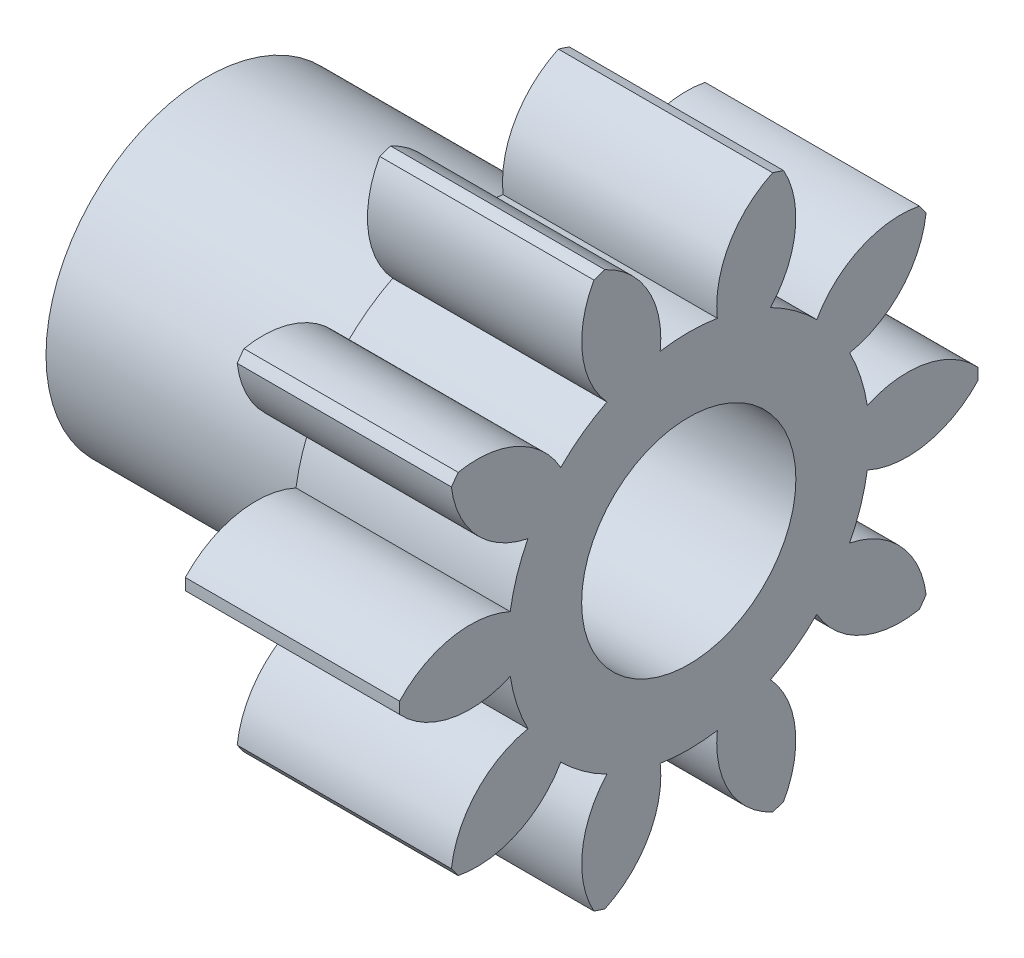
from build123d import *

# Parameters (mm, degrees)
BASPROSKE_W        = 4
BASPROSKE_H        = 5.4
TOOTHCUT_DEPTH     = 9.620904825
TEETHCUTS_COUNT    = 10
TEETHCUTS_ANGLE    = 324
HUBNEAONESKE_R     = 3
HUBNEARONE_DEPTH   = 5.0000508
BORSKE_R           = 2
BORE_DEPTH         = 9.0000508
SKETCH8_2_R        = 1.25
CUT_EXTRUDE1_DEPTH = 2
CUT_SWEEP1_PITCH   = 0.5


with BuildPart() as part:
    # BasProSke → Base-Revolve (revolve)
    with BuildSketch(Plane(origin=(0, 0, 0), x_dir=(1, 0, 0), z_dir=(0, 1, 0)), mode=Mode.PRIVATE) as base_revolve_sk:
        with Locations((2, 2.7)):
            Rectangle(BASPROSKE_W, BASPROSKE_H)
    revolve(base_revolve_sk.sketch.rotate(Axis((-10, 0, 0), (1, 0, 0)), 180), axis=Axis((-10, 0, 0), (1, 0, 0)))

    # TooCutSke → ToothCut (cut, through all)
    with BuildSketch(Plane(origin=(0, 0, 0), x_dir=(0, 0, -1), z_dir=(1, 0, 0))):
        with BuildLine():
            ThreePointArc((0.533254479, 3.331593562), (0, 3.374), (-0.533254479, 3.331593562))
            ThreePointArc((-0.533254479, 3.331593562), (-0.762529915, 4.433401636), (-1.601346956, 5.183691068))
            ThreePointArc((-1.601346956, 5.183691068), (0, 5.4254), (1.601346956, 5.183691068))
            ThreePointArc((1.601346956, 5.183691068), (0.762529915, 4.433401636), (0.533254479, 3.331593562))
        make_face()
    toothcut = extrude(amount=TOOTHCUT_DEPTH, mode=Mode.SUBTRACT)

    # TeethCuts: ToothCut ×10 about axis
    teethcuts_axis = Axis((-10, 0, 0), (1, 0, 0))
    for i in range(1, TEETHCUTS_COUNT):
        add(toothcut.rotate(teethcuts_axis, i * TEETHCUTS_ANGLE / (TEETHCUTS_COUNT - 1)), mode=Mode.SUBTRACT)

    # HubNeaOneSke → HubNearOne (add)
    with BuildSketch(Plane.ZY):
        with Locations(Location((0, 0, 0), (0, 0, 180))):
            Circle(HUBNEAONESKE_R)
    extrude(amount=HUBNEARONE_DEPTH)

    # BorSke → Bore (cut, symmetric)
    with BuildSketch(Plane(origin=(0, 0, 0), x_dir=(0, 0, -1), z_dir=(1, 0, 0))):
        with Locations(Location((0, 0, 0), (0, 0, 180))):
            Circle(BORSKE_R)
    extrude(amount=BORE_DEPTH, both=True, mode=Mode.SUBTRACT)

    # Sketch8<2> → Cut-Extrude1 (cut)
    with BuildSketch(Plane(origin=(0, -3, 0), x_dir=(-1, 0, 0), z_dir=(0, -1, 0))):
        with Locations(Location((2.5, 0, 0), (0, 0, 90))):
            Circle(SKETCH8_2_R)
    extrude(amount=-CUT_EXTRUDE1_DEPTH, mode=Mode.SUBTRACT)

    # Cut-Sweep1: arcs per turn and ends read off the stored shape
    # Cut-Sweep1: the profile of Sketch10 profile screwed along a right-hand helix through 7 turns, 6 arcs to a turn; built about Z, then put on its axis
    cut_sweep1_z = Axis((0, 0, 0), (0, 0, 1))
    cut_sweep1_corners = [(1.2497, 0, -0.372644269), (1.425, 0, -0.473853771), (1.45, 0, -0.517155041), (1.425, 0, -0.560456311), (1.2497, 0, -0.661665813)]
    with BuildLine(mode=Mode.PRIVATE) as cut_sweep1_profile:
        Line(cut_sweep1_corners[0], cut_sweep1_corners[1])
        Line(cut_sweep1_corners[3], cut_sweep1_corners[4])
        Line(cut_sweep1_corners[4], cut_sweep1_corners[0])
        ThreePointArc((1.425, 0, -0.473853771), (1.44330127, 0, -0.492155041), (1.45, 0, -0.517155041))
        ThreePointArc((1.45, 0, -0.517155041), (1.44330127, 0, -0.542155041), (1.425, 0, -0.560456311))
    cut_sweep1_cap = Face(cut_sweep1_profile.wire())
    cut_sweep1_arcs = [((1.425, 0, -0.473853771), (1.45, 0, -0.488287527), (1.45, 0, -0.517155041), (1, 0.8660254037844333, 1)), ((1.45, 0, -0.517155041), (1.45, 0, -0.546022554), (1.425, 0, -0.560456311), (1, 0.8660254037844333, 1))]  # start, shoulder, end, weights
    cut_sweep1_turn_angles = [0, 30, 60, 90, 120, 150, 180, 210, 240, 270, 300, 330, 360]
    cut_sweep1_turn_weights = [1, 0.8660254037844387, 1, 0.8660254037844387, 1, 0.8660254037844387, 1, 0.8660254037844387, 1, 0.8660254037844387, 1, 0.8660254037844387, 1]
    cut_sweep1_turn_rails = [Edge.make_bspline([Vector(p[0], p[1], 0).rotate(cut_sweep1_z, cut_sweep1_turn_angles[k]) / cut_sweep1_turn_weights[k] + Vector(0, 0, p[2] + CUT_SWEEP1_PITCH * cut_sweep1_turn_angles[k] / 360) for k in range(13)], [0, 0, 0, 1, 1, 2, 2, 3, 3, 4, 4, 5, 5, 6, 6, 6], 2, cut_sweep1_turn_weights) for p in cut_sweep1_corners]
    cut_sweep1_turn_sides = [*[Face.make_surface_from_curves(cut_sweep1_turn_rails[p[0]], cut_sweep1_turn_rails[p[1]]) for p in [(0, 1), (3, 4), (4, 0)]], *[Face.make_bezier_surface([[Vector(p[j][0], p[j][1], 0).rotate(cut_sweep1_z, cut_sweep1_turn_angles[2 * i + k]) / cut_sweep1_turn_weights[2 * i + k] + Vector(0, 0, p[j][2] + CUT_SWEEP1_PITCH * cut_sweep1_turn_angles[2 * i + k] / 360) for k in range(3)] for j in range(3)], [[p[3][j] * cut_sweep1_turn_weights[2 * i + k] for k in range(3)] for j in range(3)]) for p in cut_sweep1_arcs for i in range(6)]]
    cut_sweep1 = Plane(origin=(-2.5, -3, 0), x_dir=(-1, 0, 0), z_dir=(0, 1, 0)) * Solid(Shell([*[p.moved(Location((0, 0, CUT_SWEEP1_PITCH * i))) for i in range(7) for p in cut_sweep1_turn_sides], cut_sweep1_cap, cut_sweep1_cap.rotate(cut_sweep1_z, 2520).moved(Location((0, 0, CUT_SWEEP1_PITCH * 2520 / 360)))]))
    add(cut_sweep1, mode=Mode.SUBTRACT)


solid = part.part
